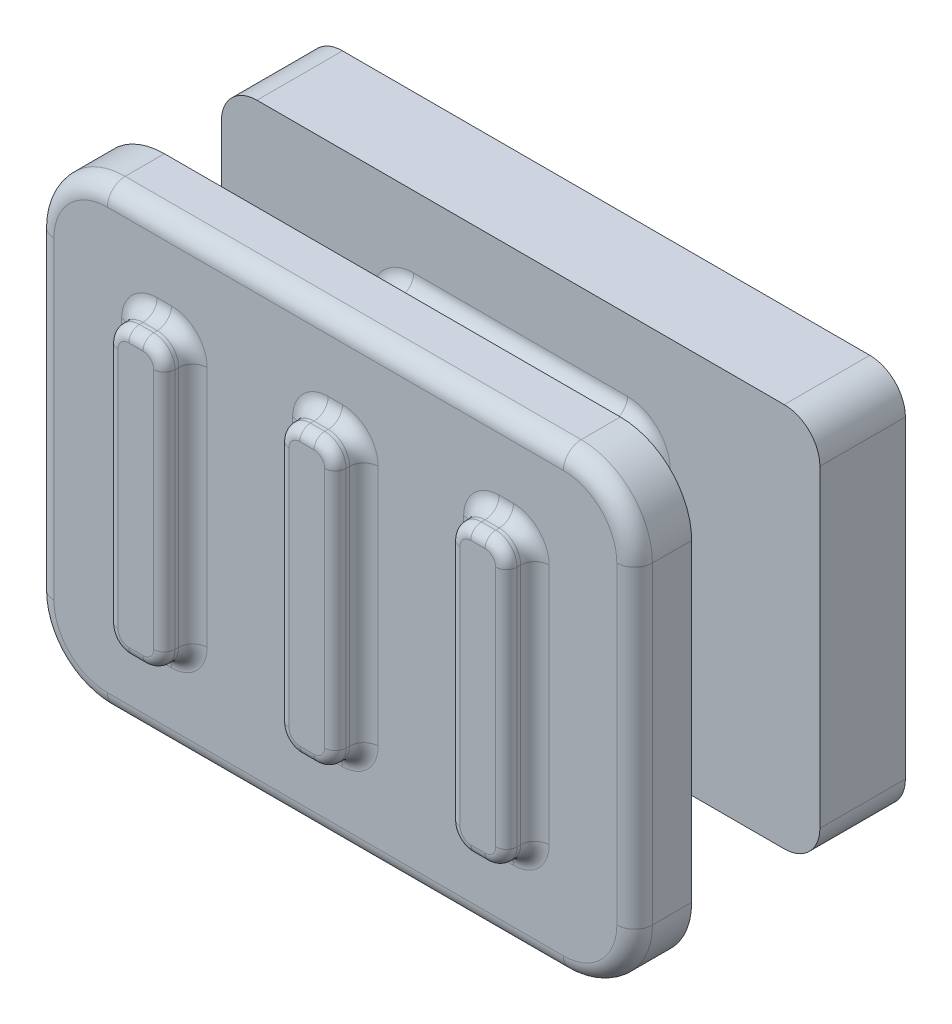
from build123d import *

# Parameters (mm, degrees)
SLIDER_STEM_DEPTH         = 4.2
CAPTIVE_FLANGE_START      = 1.2
CAPTIVE_FLANGE_DEPTH      = 1.2
THUMB_PAD_START           = 4.2
THUMB_PAD_DEPTH           = 0.8
SWITCH_PIN_SOCKET_START   = 2.3
SWITCH_PIN_SOCKET_DEPTH   = 2.4
PCB_EDGE_RELIEF_START     = 0.6
PCB_EDGE_RELIEF_PROFILE_W = 4
PCB_EDGE_RELIEF_PROFILE_H = 1.05
PCB_EDGE_RELIEF_DEPTH     = 0.7
STEM_SHOULDER_ROUND_R     = 0.2
THUMB_RIB_0_START         = 4.9
THUMB_RIB_0_DEPTH         = 0.5
THUMB_RIB_1_START         = 4.9
THUMB_RIB_1_DEPTH         = 0.5
THUMB_RIB_2_START         = 4.9
THUMB_RIB_2_DEPTH         = 0.5
THUMB_RIB_ROOT_ROUND_R    = 0.2
THUMB_PAD_EDGE_ROUND_R    = 0.25
THUMB_RIB_CROWN_ROUND_R   = 0.15


with BuildPart() as part:
    # Slider_stem_profile → Slider_stem (new body)
    with BuildSketch(Plane.XY):
        with BuildLine():
            Line((-1.5, -1.5), (1.5, -1.5))
            ThreePointArc((1.5, -1.5), (1.782842712, -1.382842712), (1.9, -1.1))
            Line((1.9, -1.1), (1.9, 1.1))
            ThreePointArc((1.9, 1.1), (1.782842712, 1.382842712), (1.5, 1.5))
            Line((1.5, 1.5), (-1.5, 1.5))
            ThreePointArc((-1.5, 1.5), (-1.782842712, 1.382842712), (-1.9, 1.1))
            Line((-1.9, 1.1), (-1.9, -1.1))
            ThreePointArc((-1.9, -1.1), (-1.782842712, -1.382842712), (-1.5, -1.5))
        make_face()
    extrude(amount=SLIDER_STEM_DEPTH)

    # Captive_flange_profile → Captive_flange (add)
    with BuildSketch(Plane.XY.offset(CAPTIVE_FLANGE_START)):
        with BuildLine():
            Line((-3.7, -2.7), (3.7, -2.7))
            ThreePointArc((3.7, -2.7), (4.053553391, -2.553553391), (4.2, -2.2))
            Line((4.2, -2.2), (4.2, 2.2))
            ThreePointArc((4.2, 2.2), (4.053553391, 2.553553391), (3.7, 2.7))
            Line((3.7, 2.7), (-3.7, 2.7))
            ThreePointArc((-3.7, 2.7), (-4.053553391, 2.553553391), (-4.2, 2.2))
            Line((-4.2, 2.2), (-4.2, -2.2))
            ThreePointArc((-4.2, -2.2), (-4.053553391, -2.553553391), (-3.7, -2.7))
        make_face()
    extrude(amount=CAPTIVE_FLANGE_DEPTH)

    # Thumb_pad_profile → Thumb_pad (add)
    with BuildSketch(Plane.XY.offset(THUMB_PAD_START)):
        with BuildLine():
            Line((-3.2, -3.2), (3.2, -3.2))
            ThreePointArc((3.2, -3.2), (3.907106781, -2.907106781), (4.2, -2.2))
            Line((4.2, -2.2), (4.2, 2.2))
            ThreePointArc((4.2, 2.2), (3.907106781, 2.907106781), (3.2, 3.2))
            Line((3.2, 3.2), (-3.2, 3.2))
            ThreePointArc((-3.2, 3.2), (-3.907106781, 2.907106781), (-4.2, 2.2))
            Line((-4.2, 2.2), (-4.2, -2.2))
            ThreePointArc((-4.2, -2.2), (-3.907106781, -2.907106781), (-3.2, -3.2))
        make_face()
    extrude(amount=THUMB_PAD_DEPTH)

    # Switch_pin_socket_profile → Switch_pin_socket (cut)
    with BuildSketch(Plane.XY.offset(SWITCH_PIN_SOCKET_START)):
        with BuildLine():
            Line((-0.8, -0.6), (0.8, -0.6))
            ThreePointArc((0.8, -0.6), (0.870710678, -0.570710678), (0.9, -0.5))
            Line((0.9, -0.5), (0.9, 0.5))
            ThreePointArc((0.9, 0.5), (0.870710678, 0.570710678), (0.8, 0.6))
            Line((0.8, 0.6), (-0.8, 0.6))
            ThreePointArc((-0.8, 0.6), (-0.870710678, 0.570710678), (-0.9, 0.5))
            Line((-0.9, 0.5), (-0.9, -0.5))
            ThreePointArc((-0.9, -0.5), (-0.870710678, -0.570710678), (-0.8, -0.6))
        make_face()
    extrude(amount=-SWITCH_PIN_SOCKET_DEPTH, mode=Mode.SUBTRACT)

    # PCB_edge_relief_profile → PCB_edge_relief (cut)
    with BuildSketch(Plane.XY.offset(PCB_EDGE_RELIEF_START)):
        with Locations((0, 1.075)):
            Rectangle(PCB_EDGE_RELIEF_PROFILE_W, PCB_EDGE_RELIEF_PROFILE_H)
    extrude(amount=-PCB_EDGE_RELIEF_DEPTH, mode=Mode.SUBTRACT)

    # Stem_shoulder_round
    stem_shoulder_round_edges = [part.edges().sort_by_distance(p)[0] for p in [
        (1.782842712, -1.382842712, 1.2),
        (-1.782842712, -1.382842712, 1.2),
        (-1.782842712, 1.382842712, 1.2),
        (1.782842712, 1.382842712, 1.2),
        (1.782842712, -1.382842712, 2.4),
        (-1.782842712, -1.382842712, 2.4),
        (-1.782842712, 1.382842712, 2.4),
        (1.782842712, 1.382842712, 2.4),
        (-1.782842712, -1.382842712, 4.2),
        (-1.782842712, 1.382842712, 4.2),
        (1.782842712, 1.382842712, 4.2),
        (1.782842712, -1.382842712, 4.2),
        (0, 1.5, 1.2),
        (-1.9, 0, 1.2),
        (0, -1.5, 1.2),
        (1.9, 0, 1.2),
        (0, 1.5, 2.4),
        (-1.9, 0, 2.4),
        (0, -1.5, 2.4),
        (1.9, 0, 2.4),
        (1.9, 0, 4.2),
        (0, 1.5, 4.2),
        (-1.9, 0, 4.2),
        (0, -1.5, 4.2),
    ]]
    fillet(stem_shoulder_round_edges, radius=STEM_SHOULDER_ROUND_R)

    # Thumb_rib_0_profile → Thumb_rib_0 (add)
    with BuildSketch(Plane.XY.offset(THUMB_RIB_0_START)):
        with BuildLine():
            Line((-2.5, -2), (-2.3, -2))
            ThreePointArc((-2.3, -2), (-2.087867966, -1.912132034), (-2, -1.7))
            Line((-2, -1.7), (-2, 1.7))
            ThreePointArc((-2, 1.7), (-2.087867966, 1.912132034), (-2.3, 2))
            Line((-2.3, 2), (-2.5, 2))
            ThreePointArc((-2.5, 2), (-2.712132034, 1.912132034), (-2.8, 1.7))
            Line((-2.8, 1.7), (-2.8, -1.7))
            ThreePointArc((-2.8, -1.7), (-2.712132034, -1.912132034), (-2.5, -2))
        make_face()
    extrude(amount=THUMB_RIB_0_DEPTH)

    # Thumb_rib_1_profile → Thumb_rib_1 (add)
    with BuildSketch(Plane.XY.offset(THUMB_RIB_1_START)):
        with BuildLine():
            Line((-0.1, -2), (0.1, -2))
            ThreePointArc((0.1, -2), (0.312132034, -1.912132034), (0.4, -1.7))
            Line((0.4, -1.7), (0.4, 1.7))
            ThreePointArc((0.4, 1.7), (0.312132034, 1.912132034), (0.1, 2))
            Line((0.1, 2), (-0.1, 2))
            ThreePointArc((-0.1, 2), (-0.312132034, 1.912132034), (-0.4, 1.7))
            Line((-0.4, 1.7), (-0.4, -1.7))
            ThreePointArc((-0.4, -1.7), (-0.312132034, -1.912132034), (-0.1, -2))
        make_face()
    extrude(amount=THUMB_RIB_1_DEPTH)

    # Thumb_rib_2_profile → Thumb_rib_2 (add)
    with BuildSketch(Plane.XY.offset(THUMB_RIB_2_START)):
        with BuildLine():
            Line((2.3, -2), (2.5, -2))
            ThreePointArc((2.5, -2), (2.712132034, -1.912132034), (2.8, -1.7))
            Line((2.8, -1.7), (2.8, 1.7))
            ThreePointArc((2.8, 1.7), (2.712132034, 1.912132034), (2.5, 2))
            Line((2.5, 2), (2.3, 2))
            ThreePointArc((2.3, 2), (2.087867966, 1.912132034), (2, 1.7))
            Line((2, 1.7), (2, -1.7))
            ThreePointArc((2, -1.7), (2.087867966, -1.912132034), (2.3, -2))
        make_face()
    extrude(amount=THUMB_RIB_2_DEPTH)

    # Thumb_rib_root_round
    thumb_rib_root_round_edges = [part.edges().sort_by_distance(p)[0] for p in [
        (2.087867966, -1.912132034, 5),
        (2.4, -2, 5),
        (2.712132034, -1.912132034, 5),
        (2.712132034, 1.912132034, 5),
        (2.4, 2, 5),
        (2.087867966, 1.912132034, 5),
        (-0.312132034, -1.912132034, 5),
        (0, -2, 5),
        (0.312132034, -1.912132034, 5),
        (0.312132034, 1.912132034, 5),
        (0, 2, 5),
        (-0.312132034, 1.912132034, 5),
        (-2.712132034, -1.912132034, 5),
        (-2.4, -2, 5),
        (-2.087867966, -1.912132034, 5),
        (-2.087867966, 1.912132034, 5),
        (-2.4, 2, 5),
        (-2.712132034, 1.912132034, 5),
        (2.8, 0, 5),
        (2, 0, 5),
        (0.4, 0, 5),
        (-0.4, 0, 5),
        (-2, 0, 5),
        (-2.8, 0, 5),
    ]]
    fillet(thumb_rib_root_round_edges, radius=THUMB_RIB_ROOT_ROUND_R)

    # Thumb_pad_edge_round
    thumb_pad_edge_round_edges = [part.edges().sort_by_distance(p)[0] for p in [
        (-3.907106781, -2.907106781, 5),
        (-4.2, 0, 5),
        (0, -3.2, 5),
        (-3.907106781, 2.907106781, 5),
        (3.907106781, -2.907106781, 5),
        (0, 3.2, 5),
        (4.2, 0, 5),
        (3.907106781, 2.907106781, 5),
    ]]
    fillet(thumb_pad_edge_round_edges, radius=THUMB_PAD_EDGE_ROUND_R)

    # Thumb_rib_crown_round
    thumb_rib_crown_round_edges = [part.edges().sort_by_distance(p)[0] for p in [
        (2.8, 0, 5.4),
        (2.712132034, 1.912132034, 5.4),
        (2.712132034, -1.912132034, 5.4),
        (2.4, 2, 5.4),
        (2.4, -2, 5.4),
        (2.087867966, 1.912132034, 5.4),
        (2.087867966, -1.912132034, 5.4),
        (2, 0, 5.4),
        (0.4, 0, 5.4),
        (0.312132034, 1.912132034, 5.4),
        (0.312132034, -1.912132034, 5.4),
        (0, 2, 5.4),
        (0, -2, 5.4),
        (-0.312132034, 1.912132034, 5.4),
        (-0.312132034, -1.912132034, 5.4),
        (-0.4, 0, 5.4),
        (-2, 0, 5.4),
        (-2.087867966, 1.912132034, 5.4),
        (-2.087867966, -1.912132034, 5.4),
        (-2.4, 2, 5.4),
        (-2.4, -2, 5.4),
        (-2.712132034, 1.912132034, 5.4),
        (-2.712132034, -1.912132034, 5.4),
        (-2.8, 0, 5.4),
    ]]
    fillet(thumb_rib_crown_round_edges, radius=THUMB_RIB_CROWN_ROUND_R)


solid = part.part
